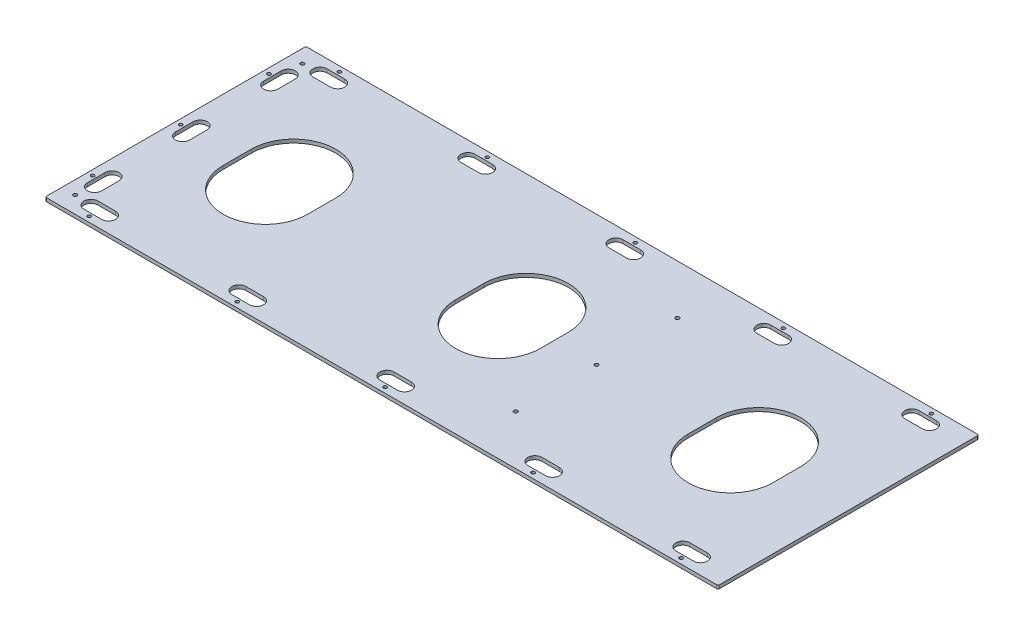
from build123d import *

# Parameters (mm, degrees)
SKETCH1_W           = 1212.85
SKETCH1_H           = 469.9
BOSS_EXTRUDE1_DEPTH = 6.35
CUT_EXTRUDE1_DEPTH  = 1301.711903152
SKETCH4_R           = 3.175
CUT_EXTRUDE3_DEPTH  = 1301.711903152
LPATTERN1_OUTLINE_R = 3.175
LPATTERN1_DEPTH     = 6.35
FILLET1_R           = 2.54
SKETCH5_R           = 3.3782
CUT_EXTRUDE4_DEPTH  = 6.35


# Read off the part's stored shape, not the designer's step: LPattern1
with BuildPart() as part:
    # Sketch1 → Boss-Extrude1 (new body)
    with BuildSketch(Plane(origin=(0, 0, 0), x_dir=(1, 0, 0), z_dir=(0, 1, 0))):
        with Locations((606.425, 234.95)):
            Rectangle(SKETCH1_W, SKETCH1_H)
    extrude(amount=BOSS_EXTRUDE1_DEPTH)

    # Sketch2 → Cut-Extrude1 (cut, through all)
    with BuildSketch(Plane(origin=(0, 6.35, 0), x_dir=(1, 0, 0), z_dir=(0, 1, 0))):
        with BuildLine():
            Line((263.525, 260.35), (263.525, 209.55))
            ThreePointArc((263.525, 209.55), (187.325, 133.35), (111.125, 209.55))
            Line((111.125, 209.55), (111.125, 260.35))
            ThreePointArc((111.125, 260.35), (187.325, 336.55), (263.525, 260.35))
        make_face()
        with BuildLine():
            Line((682.625, 260.35), (682.625, 209.55))
            ThreePointArc((682.625, 209.55), (606.425, 133.35), (530.225, 209.55))
            Line((530.225, 209.55), (530.225, 260.35))
            ThreePointArc((530.225, 260.35), (606.425, 336.55), (682.625, 260.35))
        make_face()
        with BuildLine():
            Line((1101.725, 260.35), (1101.725, 209.55))
            ThreePointArc((1101.725, 209.55), (1025.525, 133.35), (949.325, 209.55))
            Line((949.325, 209.55), (949.325, 260.35))
            ThreePointArc((949.325, 260.35), (1025.525, 336.55), (1101.725, 260.35))
        make_face()
    extrude(amount=-CUT_EXTRUDE1_DEPTH, mode=Mode.SUBTRACT)

    # Sketch4 → Cut-Extrude3 (cut, through all)
    with BuildSketch(Plane(origin=(0, 6.35, 0), x_dir=(1, 0, 0), z_dir=(0, 1, 0))):
        with Locations(Location((9.525, 393.7, 0), (0, 0, 270))):
            Circle(SKETCH4_R)
        with Locations(Location((9.525, 234.95, 0), (0, 0, 270))):
            Circle(SKETCH4_R)
        with Locations(Location((9.525, 76.2, 0), (0, 0, 270))):
            Circle(SKETCH4_R)
        with Locations(Location((69.85, 460.375, 0), (0, 0, 270))):
            Circle(SKETCH4_R)
        with Locations(Location((69.85, 9.525, 0), (0, 0, 270))):
            Circle(SKETCH4_R)
        with BuildLine():
            Line((41.275, 250.825), (41.275, 219.075))
            ThreePointArc((41.275, 219.075), (28.575, 206.375), (15.875, 219.075))
            Line((15.875, 219.075), (15.875, 250.825))
            ThreePointArc((15.875, 250.825), (28.575, 263.525), (41.275, 250.825))
        make_face()
        with BuildLine():
            Line((53.975, 454.025), (85.725, 454.025))
            ThreePointArc((85.725, 454.025), (98.425, 441.325), (85.725, 428.625))
            Line((85.725, 428.625), (53.975, 428.625))
            ThreePointArc((53.975, 428.625), (41.275, 441.325), (53.975, 454.025))
        make_face()
        with BuildLine():
            Line((53.975, 41.275), (85.725, 41.275))
            ThreePointArc((85.725, 41.275), (98.425, 28.575), (85.725, 15.875))
            Line((85.725, 15.875), (53.975, 15.875))
            ThreePointArc((53.975, 15.875), (41.275, 28.575), (53.975, 41.275))
        make_face()
        with BuildLine():
            Line((15.875, 60.325), (15.875, 92.075))
            ThreePointArc((15.875, 92.075), (28.575, 104.775), (41.275, 92.075))
            Line((41.275, 92.075), (41.275, 60.325))
            ThreePointArc((41.275, 60.325), (28.575, 47.625), (15.875, 60.325))
        make_face()
        with BuildLine():
            Line((15.875, 377.825), (15.875, 409.575))
            ThreePointArc((15.875, 409.575), (28.575, 422.275), (41.275, 409.575))
            Line((41.275, 409.575), (41.275, 377.825))
            ThreePointArc((41.275, 377.825), (28.575, 365.125), (15.875, 377.825))
        make_face()
    extrude(amount=-CUT_EXTRUDE3_DEPTH, mode=Mode.SUBTRACT)

    # LPattern1 outline → LPattern1 (cut)
    with BuildSketch(Plane(origin=(0, 0, 0), x_dir=(1, 0, 0), z_dir=(0, 1, 0))):
        with BuildLine():
            ThreePointArc((1120.775, 454.025), (1108.075, 441.325), (1120.775, 428.625))
            Line((1120.775, 428.625), (1152.525, 428.625))
            ThreePointArc((1152.525, 428.625), (1165.225, 441.325), (1152.525, 454.025))
            Line((1152.525, 454.025), (1120.775, 454.025))
        make_face()
        with BuildLine():
            ThreePointArc((854.075, 454.025), (841.375, 441.325), (854.075, 428.625))
            Line((854.075, 428.625), (885.825, 428.625))
            ThreePointArc((885.825, 428.625), (898.525, 441.325), (885.825, 454.025))
            Line((885.825, 454.025), (854.075, 454.025))
        make_face()
        with BuildLine():
            ThreePointArc((587.375, 454.025), (574.675, 441.325), (587.375, 428.625))
            Line((587.375, 428.625), (619.125, 428.625))
            ThreePointArc((619.125, 428.625), (631.825, 441.325), (619.125, 454.025))
            Line((619.125, 454.025), (587.375, 454.025))
        make_face()
        with BuildLine():
            ThreePointArc((320.675, 454.025), (307.975, 441.325), (320.675, 428.625))
            Line((320.675, 428.625), (352.425, 428.625))
            ThreePointArc((352.425, 428.625), (365.125, 441.325), (352.425, 454.025))
            Line((352.425, 454.025), (320.675, 454.025))
        make_face()
        with BuildLine():
            ThreePointArc((1120.775, 41.275), (1108.075, 28.575), (1120.775, 15.875))
            Line((1120.775, 15.875), (1152.525, 15.875))
            ThreePointArc((1152.525, 15.875), (1165.225, 28.575), (1152.525, 41.275))
            Line((1152.525, 41.275), (1120.775, 41.275))
        make_face()
        with BuildLine():
            ThreePointArc((854.075, 41.275), (841.375, 28.575), (854.075, 15.875))
            Line((854.075, 15.875), (885.825, 15.875))
            ThreePointArc((885.825, 15.875), (898.525, 28.575), (885.825, 41.275))
            Line((885.825, 41.275), (854.075, 41.275))
        make_face()
        with BuildLine():
            ThreePointArc((587.375, 41.275), (574.675, 28.575), (587.375, 15.875))
            Line((587.375, 15.875), (619.125, 15.875))
            ThreePointArc((619.125, 15.875), (631.825, 28.575), (619.125, 41.275))
            Line((619.125, 41.275), (587.375, 41.275))
        make_face()
        with BuildLine():
            ThreePointArc((320.675, 41.275), (307.975, 28.575), (320.675, 15.875))
            Line((320.675, 15.875), (352.425, 15.875))
            ThreePointArc((352.425, 15.875), (365.125, 28.575), (352.425, 41.275))
            Line((352.425, 41.275), (320.675, 41.275))
        make_face()
        with Locations((1136.65, 9.525)):
            Circle(LPATTERN1_OUTLINE_R)
        with Locations((1136.65, 460.375)):
            Circle(LPATTERN1_OUTLINE_R)
        with Locations((869.95, 9.525)):
            Circle(LPATTERN1_OUTLINE_R)
        with Locations((869.95, 460.375)):
            Circle(LPATTERN1_OUTLINE_R)
        with Locations((603.25, 9.525)):
            Circle(LPATTERN1_OUTLINE_R)
        with Locations((603.25, 460.375)):
            Circle(LPATTERN1_OUTLINE_R)
        with Locations((336.55, 9.525)):
            Circle(LPATTERN1_OUTLINE_R)
        with Locations((336.55, 460.375)):
            Circle(LPATTERN1_OUTLINE_R)
    extrude(amount=LPATTERN1_DEPTH, mode=Mode.SUBTRACT)

    # Fillet1
    fillet1_edges = [part.edges().sort_by_distance(p)[0] for p in [
        (0, 3.175, 0),
        (0, 3.175, -469.9),
        (1212.85, 3.175, -469.9),
        (1212.85, 3.175, 0),
    ]]
    fillet(fillet1_edges, radius=FILLET1_R)

    # Sketch5 → Cut-Extrude4 (cut)
    with BuildSketch(Plane(origin=(0, 6.35, 0), x_dir=(1, 0, 0), z_dir=(0, 1, 0))):
        with Locations(Location((23.8125, 439.7375, 0), (0, 0, 270))):
            Circle(SKETCH5_R)
        with Locations(Location((23.8125, 30.1625, 0), (0, 0, 270))):
            Circle(SKETCH5_R)
        with Locations(Location((758.825, 89.154, 0), (0, 0, 270))):
            Circle(SKETCH5_R)
        with Locations(Location((758.825, 234.95, 0), (0, 0, 270))):
            Circle(SKETCH5_R)
        with Locations(Location((758.825, 380.746, 0), (0, 0, 270))):
            Circle(SKETCH5_R)
    extrude(amount=-CUT_EXTRUDE4_DEPTH, mode=Mode.SUBTRACT)


solid = part.part
